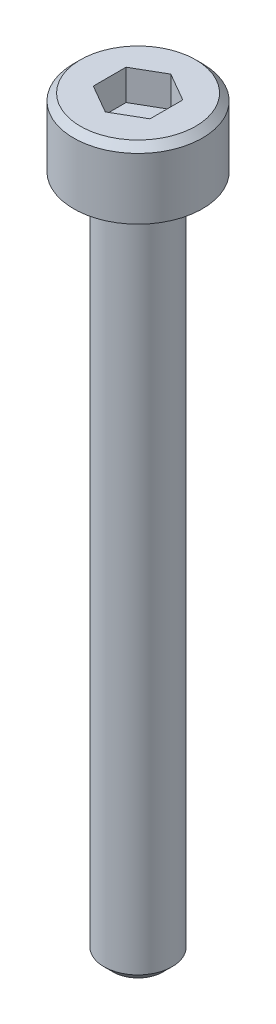
from build123d import *

# Parameters (mm, degrees)
CUT_EXTRUDE1_DEPTH = 1.35


with BuildPart() as part:
    # Sketch1 → Revolve1 (revolve)
    with BuildSketch(Plane.XY):
        Polygon((0, -30), (1.1, -30), (1.5, -29.6), (1.5, 0), (2.84, 0), (2.84, 2.7), (2.54, 3), (0, 3), align=None)
    revolve(axis=Axis((0, -10, 0), (0, 1, 0)))

    # Sketch2 → Cut-Extrude1 (cut)
    with BuildSketch(Plane(origin=(0, 3, 0), x_dir=(1, 0, 0), z_dir=(0, 1, 0))):
        Polygon((1.25, -0.721687836), (0, -1.443375673), (-1.25, -0.721687836), (-1.25, 0.721687836), (0, 1.443375673), (1.25, 0.721687836), align=None)
    extrude(amount=-CUT_EXTRUDE1_DEPTH, mode=Mode.SUBTRACT)


solid = part.part
